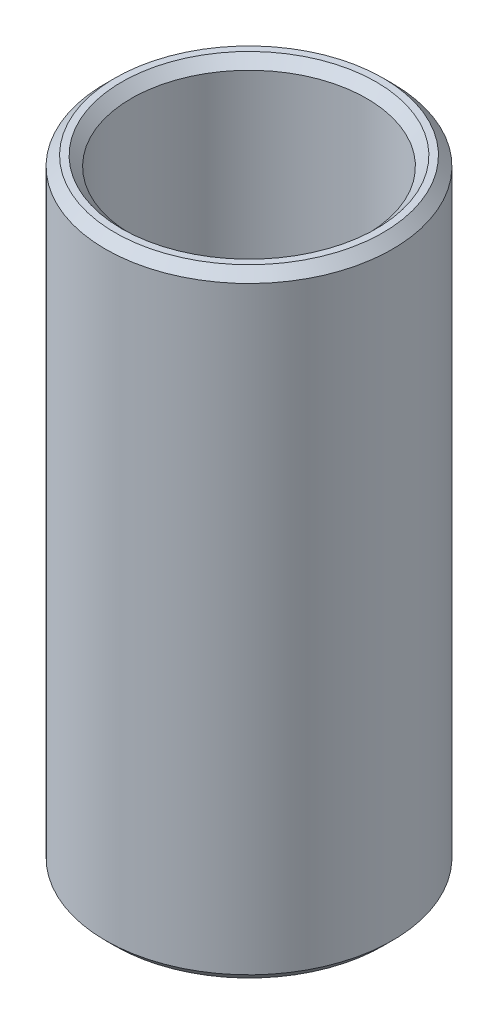
from build123d import *

# Parameters (mm, degrees)
SKETCH1_R           = 22.5
BOSS_EXTRUDE1_DEPTH = 96.851999222
SKETCH2_R           = 18.452386423
CUT_EXTRUDE1_DEPTH  = 102.945131092
CHAMFER1_SIZE       = 1.49377692


with BuildPart() as part:
    # Sketch1 → Boss-Extrude1 (new body)
    with BuildSketch(Plane(origin=(0, 0, 0), x_dir=(1, 0, 0), z_dir=(0, 1, 0))):
        Circle(SKETCH1_R)
    extrude(amount=BOSS_EXTRUDE1_DEPTH)

    # Sketch2 → Cut-Extrude1 (cut, through all)
    with BuildSketch(Plane(origin=(0, 0, 0), x_dir=(1, 0, 0), z_dir=(0, 1, 0))):
        Circle(SKETCH2_R)
    extrude(amount=CUT_EXTRUDE1_DEPTH, mode=Mode.SUBTRACT)

    # Chamfer1
    chamfer1_edges = [part.edges().sort_by_distance(p)[0] for p in [
        (-18.452386423, 96.851999222, 0),
        (-18.452386423, 0, 0),
        (-22.5, 0, 0),
        (-22.5, 96.851999222, 0),
    ]]
    chamfer(chamfer1_edges, length=CHAMFER1_SIZE)


solid = part.part
